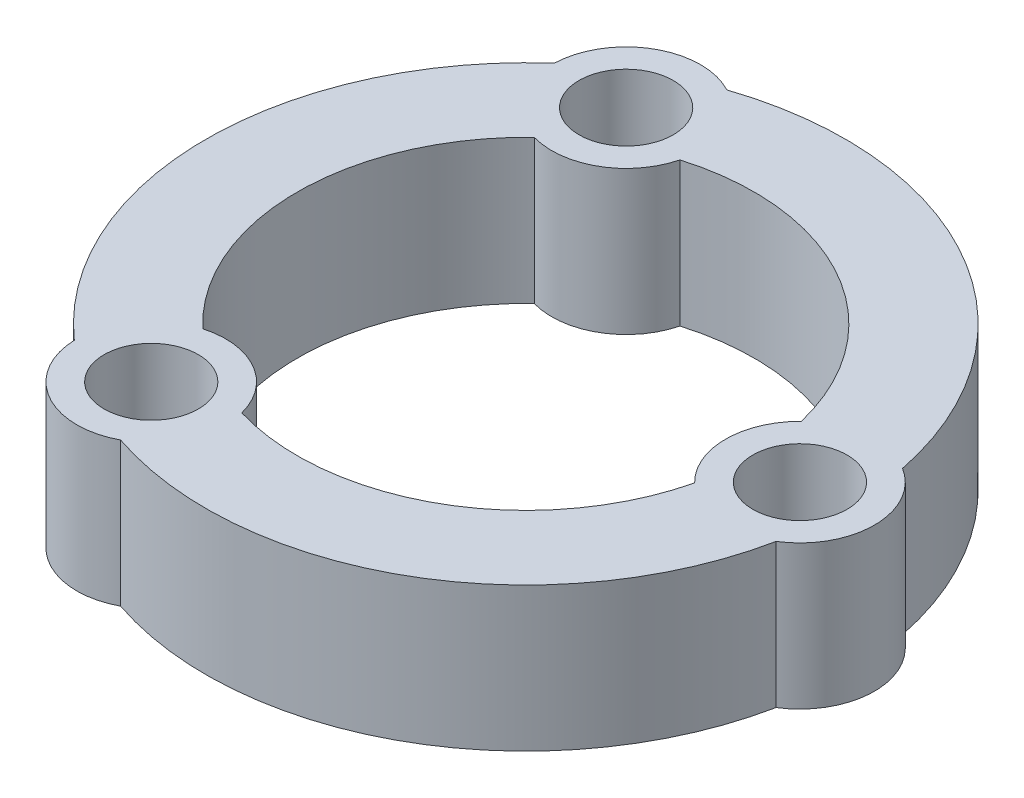
from build123d import *

# Parameters (mm, degrees)
BOSS_EXTRUDE1_DEPTH = 10
SKETCH3_R           = 3.275
CUT_EXTRUDE1_DEPTH  = 7.5
CIRPATTERN1_COUNT   = 3


with BuildPart() as part:
    # Sketch1 → Boss-Extrude1 (new body)
    with BuildSketch(Plane(origin=(0, 0, 0), x_dir=(1, 0, 0), z_dir=(0, 1, 0))):
        with BuildLine():
            ThreePointArc((21.789237305, -4.392140016), (24.2275, 0), (21.789237305, 4.392140016))
            ThreePointArc((21.789237305, 4.392140016), (11.11375, 19.249579663), (-7.090913821, 21.066103043))
            ThreePointArc((-7.090913821, 21.066103043), (-12.11375, 20.98163047), (-14.698323484, 16.673963027))
            ThreePointArc((-14.698323484, 16.673963027), (-22.2275, 0), (-14.698323484, -16.673963027))
            ThreePointArc((-14.698323484, -16.673963027), (-12.11375, -20.98163047), (-7.090913821, -21.066103043))
            ThreePointArc((-7.090913821, -21.066103043), (11.11375, -19.249579663), (21.789237305, -4.392140016))
        make_face()
        with BuildLine():
            ThreePointArc((-4.511236152, 15.223132222), (7.93875, 13.750318349), (15.439237305, 3.704721001))
            ThreePointArc((15.439237305, 3.704721001), (13.8775, 0), (15.439237305, -3.704721001))
            ThreePointArc((15.439237305, -3.704721001), (7.93875, -13.750318349), (-4.511236152, -15.223132222))
            ThreePointArc((-4.511236152, -15.223132222), (-6.93875, -12.018267541), (-10.928001153, -11.518411221))
            ThreePointArc((-10.928001153, -11.518411221), (-15.8775, 0), (-10.928001153, 11.518411221))
            ThreePointArc((-10.928001153, 11.518411221), (-6.93875, 12.018267541), (-4.511236152, 15.223132222))
        make_face(mode=Mode.SUBTRACT)
    extrude(amount=BOSS_EXTRUDE1_DEPTH)

    # Sketch3 → Cut-Extrude1 (cut)
    with BuildSketch(Plane(origin=(0, 10, 0), x_dir=(1, 0, 0), z_dir=(0, 1, 0))):
        with Locations((19.0525, 0)):
            Circle(SKETCH3_R)
    cut_extrude1 = extrude(amount=-CUT_EXTRUDE1_DEPTH, mode=Mode.SUBTRACT)

    # CirPattern1: Cut-Extrude1 ×3 about axis
    cirpattern1_axis = Axis((0, 10, 0), (0, 1, 0))
    for i in range(1, CIRPATTERN1_COUNT):
        add(cut_extrude1.rotate(cirpattern1_axis, i * 360 / CIRPATTERN1_COUNT), mode=Mode.SUBTRACT)


solid = part.part
